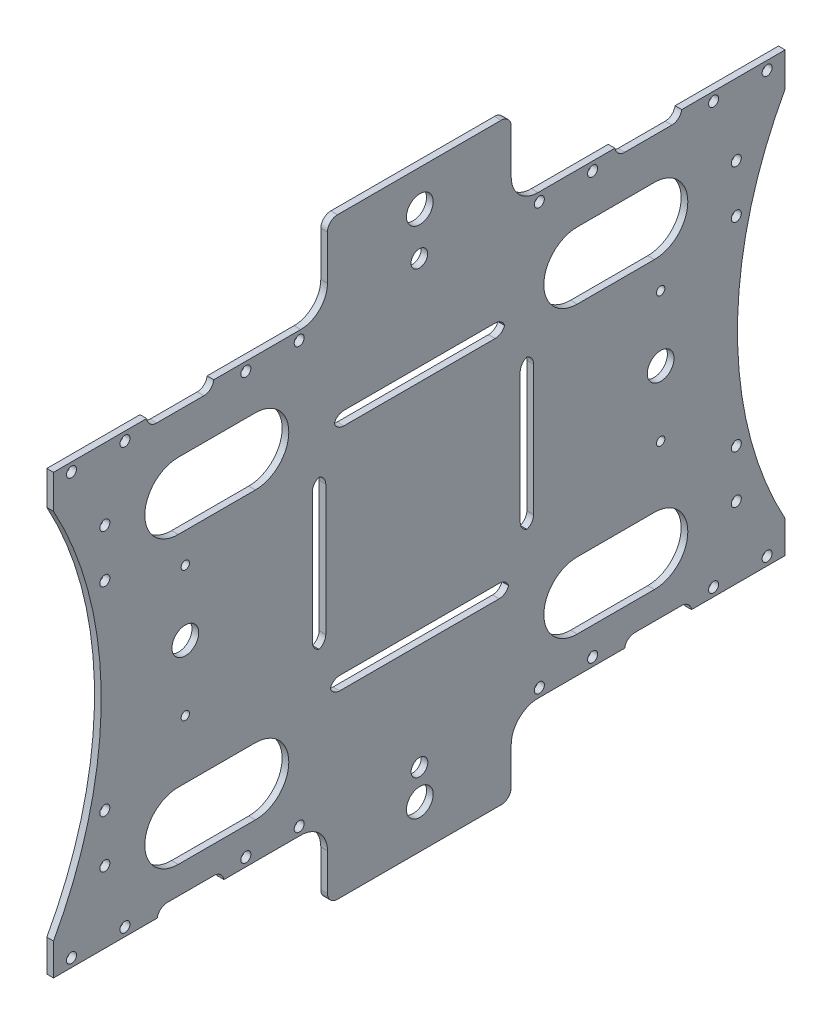
from build123d import *

# Parameters (mm, degrees)
SKETCH1_W           = 219
SKETCH1_H           = 131.094554082
BOSS_EXTRUDE1_DEPTH = 2
SKETCH2_R           = 1.5
CUT_EXTRUDE1_DEPTH  = 2
SKETCH3_W           = 20.100718227
SKETCH3_H           = 5.311130235
SKETCH3_W_2         = 20.021358258
SKETCH3_H_2         = 5.064277487
SKETCH3_W_3         = 19.940859064
SKETCH3_H_3         = 5.08276585
SKETCH3_W_4         = 20.006641617
SKETCH3_H_4         = 5.082063379
CUT_EXTRUDE2_DEPTH  = 2
FILLET1_R           = 3
SKETCH4_R           = 1.5
CUT_EXTRUDE3_DEPTH  = 2
SKETCH5_R           = 1.25
SKETCH5_R_2         = 4
SKETCH5_W           = 4
SKETCH5_H           = 45
CUT_EXTRUDE4_DEPTH  = 10
SKETCH6_W           = 55
SKETCH6_H           = 54.456850543
BOSS_EXTRUDE2_DEPTH = 2
FILLET2_R           = 8
FILLET3_R           = 3
SKETCH7_R           = 4
CUT_EXTRUDE5_DEPTH  = 10
SKETCH8_R           = 2.5
SKETCH8_W           = 51.317302969
SKETCH8_H           = 4
SKETCH8_W_2         = 53.737908292
CUT_EXTRUDE6_DEPTH  = 3
FILLET4_R           = 3


with BuildPart() as part:
    # Sketch1 → Boss-Extrude1 (new body)
    with BuildSketch(Plane(origin=(0, 0, 0), x_dir=(0, 0, -1), z_dir=(1, 0, 0))):
        with Locations((-73.162232803, 21.741964745)):
            Rectangle(SKETCH1_W, SKETCH1_H)
    extrude(amount=BOSS_EXTRUDE1_DEPTH)

    # Sketch2 → Cut-Extrude1 (cut)
    with BuildSketch(Plane(origin=(2, 0, 0), x_dir=(0, 0, -1), z_dir=(1, 0, 0))):
        with Locations((-177.27818527, 84.689917601)):
            Circle(SKETCH2_R)
        with Locations((-161.277258525, 84.689917601)):
            Circle(SKETCH2_R)
        with Locations((14.907270265, 84.689917601)):
            Circle(SKETCH2_R)
        with Locations((30.940170054, 84.689917601)):
            Circle(SKETCH2_R)
        with Locations((-125.090896887, 84.689917601)):
            Circle(SKETCH2_R)
        with Locations((-109.121189232, 84.689917601)):
            Circle(SKETCH2_R)
        with Locations((-37.23969182, 84.689917601)):
            Circle(SKETCH2_R)
        with Locations((-21.290294086, 84.689917601)):
            Circle(SKETCH2_R)
        with Locations((-177.27818527, -41.255743067)):
            Circle(SKETCH2_R)
        with Locations((-161.277258525, -41.255743067)):
            Circle(SKETCH2_R)
        with Locations((-125.090896887, -41.255743067)):
            Circle(SKETCH2_R)
        with Locations((-109.121189232, -41.255743067)):
            Circle(SKETCH2_R)
        with Locations((-21.290294086, -41.255743067)):
            Circle(SKETCH2_R)
        with Locations((-37.23969182, -41.255743067)):
            Circle(SKETCH2_R)
        with Locations((14.907270265, -41.255743067)):
            Circle(SKETCH2_R)
        with Locations((30.940170054, -41.255743067)):
            Circle(SKETCH2_R)
    extrude(amount=-CUT_EXTRUDE1_DEPTH, mode=Mode.SUBTRACT)

    # Sketch3 → Cut-Extrude2 (cut)
    with BuildSketch(Plane(origin=(2, 0, 0), x_dir=(0, 0, -1), z_dir=(1, 0, 0))):
        with Locations((-144.733326963, 87.289241785)):
            Rectangle(SKETCH3_W, SKETCH3_H)
        with Locations((-4.626373242, 87.289241786)):
            Rectangle(SKETCH3_W_2, SKETCH3_H_2)
        with Locations((-141.63316605, -43.805312296)):
            Rectangle(SKETCH3_W_3, SKETCH3_H_3)
        with Locations((-1.696074774, -43.805312296)):
            Rectangle(SKETCH3_W_4, SKETCH3_H_4)
    extrude(amount=-CUT_EXTRUDE2_DEPTH, mode=Mode.SUBTRACT)

    # Fillet1
    # the kernel refuses this fillet: 3 mm, written as the material it adds along each edge
    with BuildSketch(Plane(origin=(2, 84.633676668, 154.783686076), x_dir=(0, 1, 0), z_dir=(-1, 0, 0))) as fillet1_piece_1:
        with BuildLine():
            CenterArc((3, 2.980161843), FILLET1_R, 180, 83.407239863)
            Line((0, 2.980161843), (-0.06, 2.980161843))
            Line((-0.06, 2.980161843), (-0.06, 0))
            Line((-0.06, 0), (0, -0.06))
            ThreePointArc((0, -0.06), (1.327782559, -0.06), (2.64867642, -0.059603237))
            Line((2.64867642, -0.059603237), (2.655565117, 0))
        make_face()
    extrude(amount=2)
    with BuildSketch(Plane(origin=(2, 84.633676668, 134.682967849), x_dir=(0, 1, 0), z_dir=(-1, 0, 0))) as fillet1_piece_2:
        with BuildLine():
            CenterArc((3, -2.980161843), FILLET1_R, 96.592760137, 83.407239863)
            Line((0, -2.980161843), (-0.06, -2.980161843))
            Line((-0.06, -2.980161843), (-0.06, 0))
            Line((-0.06, 0), (0, 0.06))
            ThreePointArc((0, 0.06), (1.327782559, 0.06), (2.64867642, 0.059603237))
            Line((2.64867642, 0.059603237), (2.655565117, 0))
        make_face()
    extrude(amount=2)
    with BuildSketch(Plane(origin=(2, 84.757103042, -5.384305887), x_dir=(0, 1, 0), z_dir=(-1, 0, 0))) as fillet1_piece_3:
        with BuildLine():
            CenterArc((3, -2.963293074), FILLET1_R, 98.972114931, 81.027885069)
            Line((0, -2.963293074), (-0.06, -2.963293074))
            Line((-0.06, -2.963293074), (-0.06, 0))
            Line((-0.06, 0), (0, 0.06))
            ThreePointArc((0, 0.06), (1.266069372, 0.06), (2.522781518, 0.059265861))
            Line((2.522781518, 0.059265861), (2.532138743, 0))
        make_face()
    extrude(amount=2)
    with BuildSketch(Plane(origin=(2, 84.757103042, 14.637052371), x_dir=(0, 0, -1), z_dir=(-1, 0, 0))) as fillet1_piece_4:
        with BuildLine():
            CenterArc((2.963293074, -3), FILLET1_R, 90, 81.027885069)
            Line((0, -2.532138743), (-0.059265861, -2.522781518))
            ThreePointArc((-0.059265861, -2.522781518), (-0.06, -1.266069372), (-0.06, 0))
            Line((-0.06, 0), (0, 0.06))
            Line((0, 0.06), (2.963293074, 0.06))
            Line((2.963293074, 0.06), (2.963293074, 0))
        make_face()
    extrude(amount=2)
    with BuildSketch(Plane(origin=(2, -41.264280606, 11.699395582), x_dir=(0, -1, 0), z_dir=(-1, 0, 0))) as fillet1_piece_5:
        with BuildLine():
            CenterArc((3, -2.964683472), FILLET1_R, 98.800208751, 81.199791249)
            Line((0, -2.964683472), (-0.06, -2.964683472))
            Line((-0.06, -2.964683472), (-0.06, 0))
            Line((-0.06, 0), (0, 0.06))
            ThreePointArc((0, 0.06), (1.270515845, 0.06), (2.531852323, 0.059293669))
            Line((2.531852323, 0.059293669), (2.54103169, 0))
        make_face()
    extrude(amount=2)
    with BuildSketch(Plane(origin=(2, -41.264280606, -8.307246035), x_dir=(0, 0, 1), z_dir=(-1, 0, 0))) as fillet1_piece_6:
        with BuildLine():
            CenterArc((2.964683472, -3), FILLET1_R, 90, 81.199791249)
            Line((0, -2.54103169), (-0.059293669, -2.531852323))
            ThreePointArc((-0.059293669, -2.531852323), (-0.06, -1.270515845), (-0.06, 0))
            Line((-0.06, 0), (0, 0.06))
            Line((0, 0.06), (2.964683472, 0.06))
            Line((2.964683472, 0.06), (2.964683472, 0))
        make_face()
    extrude(amount=2)
    with BuildSketch(Plane(origin=(2, -41.263929371, 131.662736518), x_dir=(0, 0, 1), z_dir=(-1, 0, 0))) as fillet1_piece_7:
        with BuildLine():
            CenterArc((2.964737826, -3), FILLET1_R, 90, 81.206579194)
            Line((0, -2.541382925), (-0.059294757, -2.532210583))
            ThreePointArc((-0.059294757, -2.532210583), (-0.06, -1.270691462), (-0.06, 0))
            Line((-0.06, 0), (0, 0.06))
            Line((0, 0.06), (2.964737826, 0.06))
            Line((2.964737826, 0.06), (2.964737826, 0))
        make_face()
    extrude(amount=2)
    with BuildSketch(Plane(origin=(2, -41.263929371, 151.603595582), x_dir=(0, -1, 0), z_dir=(-1, 0, 0))) as fillet1_piece_8:
        with BuildLine():
            CenterArc((3, -2.964737826), FILLET1_R, 98.793420806, 81.206579194)
            Line((0, -2.964737826), (-0.06, -2.964737826))
            Line((-0.06, -2.964737826), (-0.06, 0))
            Line((-0.06, 0), (0, 0.06))
            ThreePointArc((0, 0.06), (1.270691462, 0.06), (2.532210583, 0.059294757))
            Line((2.532210583, 0.059294757), (2.541382925, 0))
        make_face()
    extrude(amount=2)

    # Sketch4 → Cut-Extrude3 (cut)
    with BuildSketch(Plane(origin=(2, 0, 0), x_dir=(0, 0, -1), z_dir=(1, 0, 0))):
        with Locations((-167.296997749, 65.880164244)):
            Circle(SKETCH4_R)
        with Locations((-167.296997749, 51.515014112)):
            Circle(SKETCH4_R)
        with Locations((-167.296997749, -8.031084623)):
            Circle(SKETCH4_R)
        with Locations((-167.296997749, -22.396234754)):
            Circle(SKETCH4_R)
        with Locations((21.708416743, 65.880164244)):
            Circle(SKETCH4_R)
        with Locations((21.708416743, 51.515014112)):
            Circle(SKETCH4_R)
        with Locations((21.708416743, -8.031084623)):
            Circle(SKETCH4_R)
        with Locations((21.708416743, -22.396234754)):
            Circle(SKETCH4_R)
    extrude(amount=-CUT_EXTRUDE3_DEPTH, mode=Mode.SUBTRACT)

    # Sketch5 → Cut-Extrude4 (cut)
    with BuildSketch(Plane(origin=(2, 0, 0), x_dir=(0, 0, -1), z_dir=(1, 0, 0))):
        with Locations((-143.214126684, 43.480610114)):
            Circle(SKETCH5_R)
        with Locations((-143.214126684, 4.480610114)):
            Circle(SKETCH5_R)
        with Locations((-143.214126684, 23.980610114)):
            Circle(SKETCH5_R_2)
        with Locations((-0.925000289, 23.980610114)):
            Circle(SKETCH5_R_2)
        with Locations((-0.925000289, 4.480610114)):
            Circle(SKETCH5_R)
        with Locations((-0.925000289, 43.480610114)):
            Circle(SKETCH5_R)
        with BuildLine():
            Line((-182.662232803, 77.174795439), (-182.662232803, -34.218885505))
            ThreePointArc((-182.662232803, -34.218885505), (-168.383258688, 21.477954967), (-182.662232803, 77.174795439))
        make_face()
        with BuildLine():
            Line((36.337767197, 77.174795439), (36.337767197, -34.218885505))
            ThreePointArc((36.337767197, -34.218885505), (22.058793083, 21.477954967), (36.337767197, 77.174795439))
        make_face()
        with BuildLine():
            Line((-25.897141257, 72.496877719), (-2.799065676, 72.496877719))
            ThreePointArc((-2.799065676, 72.496877719), (7.200934324, 62.496877719), (-2.799065676, 52.496877719))
            Line((-2.799065676, 52.496877719), (-25.897141257, 52.496877719))
            ThreePointArc((-25.897141257, 52.496877719), (-35.897141257, 62.496877719), (-25.897141257, 72.496877719))
        make_face()
        with BuildLine():
            Line((-25.897141257, -33.027821748), (-2.799065676, -33.027821748))
            ThreePointArc((-2.799065676, -33.027821748), (7.200934324, -23.027821748), (-2.799065676, -13.027821748))
            Line((-2.799065676, -13.027821748), (-25.897141257, -13.027821748))
            ThreePointArc((-25.897141257, -13.027821748), (-35.897141257, -23.027821748), (-25.897141257, -33.027821748))
        make_face()
        with BuildLine():
            Line((-122.237776037, 72.496877719), (-145.335851618, 72.496877719))
            ThreePointArc((-145.335851618, 72.496877719), (-155.335851618, 62.496877719), (-145.335851618, 52.496877719))
            Line((-145.335851618, 52.496877719), (-122.237776037, 52.496877719))
            ThreePointArc((-122.237776037, 52.496877719), (-112.237776037, 62.496877719), (-122.237776037, 72.496877719))
        make_face()
        with BuildLine():
            Line((-122.237776037, -33.027821748), (-145.335851618, -33.027821748))
            ThreePointArc((-145.335851618, -33.027821748), (-155.335851618, -23.027821748), (-145.335851618, -13.027821748))
            Line((-145.335851618, -13.027821748), (-122.237776037, -13.027821748))
            ThreePointArc((-122.237776037, -13.027821748), (-112.237776037, -23.027821748), (-122.237776037, -33.027821748))
        make_face()
        with Locations((-103.171875577, 23.980610114)):
            Rectangle(SKETCH5_W, SKETCH5_H)
        with Locations((-40.967251396, 23.980610114)):
            Rectangle(SKETCH5_W, SKETCH5_H)
    extrude(amount=-CUT_EXTRUDE4_DEPTH, mode=Mode.SUBTRACT)

    # Sketch6 → Boss-Extrude2 (add)
    with BuildSketch(Plane(origin=(2, 0, 0), x_dir=(0, 0, -1), z_dir=(1, 0, 0))):
        with Locations((-73.162232803, 84.319953677)):
            Rectangle(SKETCH6_W, SKETCH6_H)
        with Locations((-73.162232803, -38.682270845)):
            Rectangle(SKETCH6_W, SKETCH6_H)
    extrude(amount=-BOSS_EXTRUDE2_DEPTH)

    # Fillet2
    fillet2_edges = [part.edges().sort_by_distance(p)[0] for p in [
        (1, 87.289241786, 45.662232803),
        (1, 87.289241786, 100.662232803),
        (1, -43.805312296, 100.662232803),
        (1, -43.805312296, 45.662232803),
    ]]
    fillet(fillet2_edges, radius=FILLET2_R)

    # Fillet3
    fillet3_edges = [part.edges().sort_by_distance(p)[0] for p in [
        (1, 111.548378948, 45.662232803),
        (1, 111.548378948, 100.662232803),
        (1, -65.910696116, 100.662232803),
        (1, -65.910696116, 45.662232803),
    ]]
    fillet(fillet3_edges, radius=FILLET3_R)

    # Sketch7 → Cut-Extrude5 (cut)
    with BuildSketch(Plane(origin=(2, 0, 0), x_dir=(0, 0, -1), z_dir=(1, 0, 0))):
        with Locations((-73.016623219, 100.664626398)):
            Circle(SKETCH7_R)
        with Locations((-73.016623219, -52.991297145)):
            Circle(SKETCH7_R)
    extrude(amount=-CUT_EXTRUDE5_DEPTH, mode=Mode.SUBTRACT)

    # Sketch8 → Cut-Extrude6 (cut)
    with BuildSketch(Plane(origin=(2, 0, 0), x_dir=(0, 0, -1), z_dir=(1, 0, 0))):
        with Locations((-73.162232803, 87.980610114)):
            Circle(SKETCH8_R)
        with Locations((-73.130017381, -43.925193935)):
            Circle(SKETCH8_R)
        with Locations((-73.130017382, 57.868901323)):
            Rectangle(SKETCH8_W, SKETCH8_H)
        with Locations((-73.130017381, -10.200651785)):
            Rectangle(SKETCH8_W_2, SKETCH8_H)
    extrude(amount=-CUT_EXTRUDE6_DEPTH, mode=Mode.SUBTRACT)

    # Fillet4
    # the kernel refuses this fillet: 3 mm, written as the material it adds along each edge
    with BuildSketch(Plane(origin=(2, 46.480610114, 42.967251396), x_dir=(0, 0, -1), z_dir=(-1, 0, 0)), Plane(origin=(2, 1.480610114, 42.967251396), x_dir=(0, 1, 0), z_dir=(-1, 0, 0)), Plane(origin=(2, 1.480610114, 101.171875577), x_dir=(0, 0, 1), z_dir=(-1, 0, 0)), Plane(origin=(2, 1.480610114, 105.171875577), x_dir=(0, 1, 0), z_dir=(-1, 0, 0)), Plane(origin=(2, 55.868901323, 98.788668866), x_dir=(0, 1, 0), z_dir=(-1, 0, 0)), Plane(origin=(2, 59.868901323, 47.471365897), x_dir=(0, -1, 0), z_dir=(-1, 0, 0)), Plane(origin=(2, 55.868901323, 47.471365897), x_dir=(0, 0, 1), z_dir=(-1, 0, 0)), Plane(origin=(2, -12.200651785, 46.261063235), x_dir=(0, 0, 1), z_dir=(-1, 0, 0)), Plane(origin=(2, -8.200651785, 46.261063235), x_dir=(0, -1, 0), z_dir=(-1, 0, 0)), Plane(origin=(2, -12.200651785, 99.998971527), x_dir=(0, 1, 0), z_dir=(-1, 0, 0))) as fillet4_piece_1:
        with BuildLine():
            CenterArc((FILLET4_R, FILLET4_R), FILLET4_R, 180, 90)
            Line((0, FILLET4_R), (0, 0))
            Line((0, 0), (FILLET4_R, 0))
        make_face()
    extrude(amount=2)
    with BuildSketch(Plane(origin=(2, 46.480610114, 38.967251396), x_dir=(0, 0, 1), z_dir=(-1, 0, 0)), Plane(origin=(2, 1.480610114, 38.967251396), x_dir=(0, 1, 0), z_dir=(-1, 0, 0)), Plane(origin=(2, 46.480610114, 101.171875577), x_dir=(0, 0, 1), z_dir=(-1, 0, 0)), Plane(origin=(2, 46.480610114, 105.171875577), x_dir=(0, -1, 0), z_dir=(-1, 0, 0)), Plane(origin=(2, 59.868901323, 98.788668866), x_dir=(0, -1, 0), z_dir=(-1, 0, 0)), Plane(origin=(2, -8.200651785, 99.998971527), x_dir=(0, -1, 0), z_dir=(-1, 0, 0))) as fillet4_piece_2:
        with BuildLine():
            CenterArc((FILLET4_R, -FILLET4_R), FILLET4_R, 90, 90)
            Line((0, -FILLET4_R), (0, 0))
            Line((0, 0), (FILLET4_R, 0))
        make_face()
    extrude(amount=2)


solid = part.part
